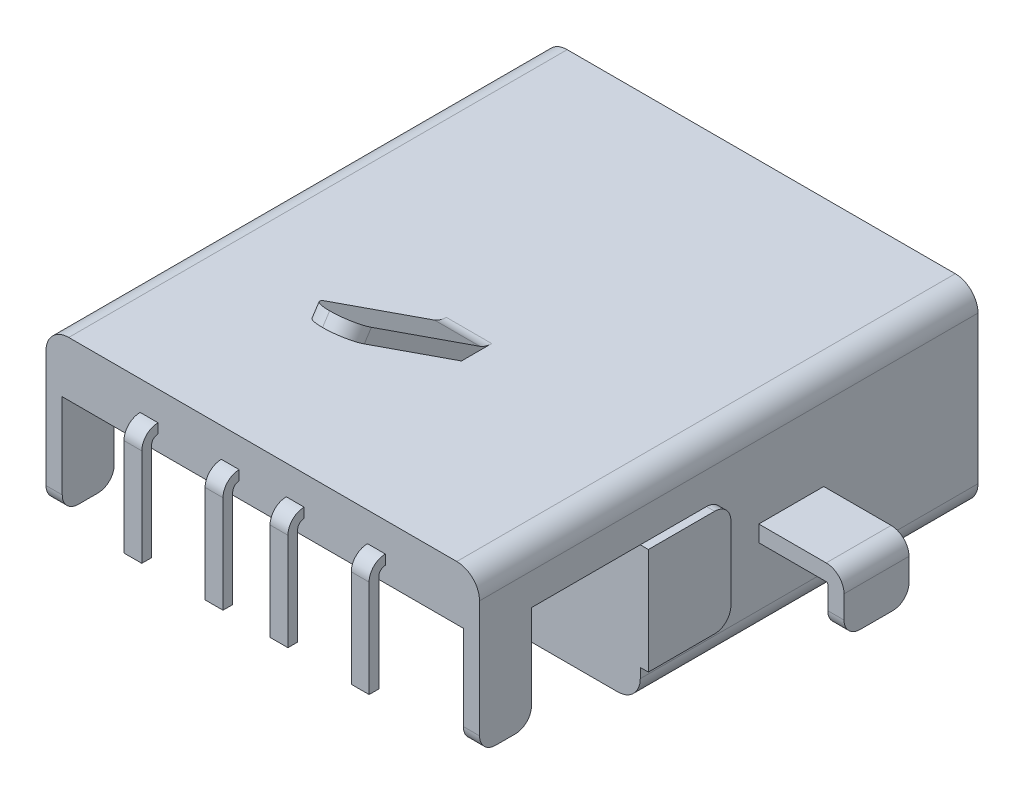
from build123d import *

# Parameters (mm, degrees)
SKIZZE1_W                         = 6.675
SKIZZE1_H                         = 4.27
AUFSATZ_LINEAR_AUSTRAGEN1_DEPTH   = 10.4
SKIZZE1_3_W                       = 6.675
SKIZZE1_3_H                       = 1.68
AUFSATZ_LINEAR_AUSTRAGEN2_DEPTH   = 15.35
LINEAR_AUSTRAGEN_D_NN1_START      = 4.75
LINEAR_AUSTRAGEN_D_NN1_DEPTH      = 2
SKIZZE3_W                         = 0.5
SKIZZE3_H                         = 1.6
AUFSATZ_LINEAR_AUSTRAGEN3_DEPTH   = 4.8
SKIZZE4_W                         = 7.337223246
SKIZZE4_H                         = 4.95
SCHNITT_LINEAR_AUSTRAGEN1_DEPTH   = 8.85
AUFSATZ_LINEAR_AUSTRAGEN4_REACH   = 21.408
AUFSATZ_LINEAR_START              = 0.5
SKIZZE5_W                         = 5.4
SKIZZE5_H                         = 2
AUFSATZ_LINEAR_START_2            = -0.9
SKIZZE6_W                         = 0.55
SKIZZE6_H                         = 0.3
AUFSATZ_LINEAR_AUSTRAGEN5_DEPTH   = 3.5
AUFSATZ_LINEAR_AUSTRAGEN5_2_DEPTH = 3.5
SKIZZE6_3_W                       = 0.55
SKIZZE6_3_H                       = 0.2
AUFSATZ_LINEAR_AUSTRAGEN6_DEPTH   = 0.3
VERRUNDUNG1_R                     = 0.2
VERRUNDUNG2_R                     = 0.5
VERRUNDUNG3_R                     = 0.3
VERRUNDUNG4_R                     = 0.7
AUFSATZ_LINEAR_START_3            = -6.675
SKIZZE7_W                         = 2.54
SKIZZE7_H                         = 3.27
AUFSATZ_LINEAR_AUSTRAGEN7_DEPTH   = 0.25
VERRUNDUNG6_R                     = 0.5
VERRUNDUNG7_R                     = 0.5
LINEAR_AUSTRAGEN_D_NN2_DEPTH      = 0.7
VERRUNDUNG5_R                     = 0.7


with BuildPart() as part:
    # Skizze1 → Aufsatz-Linear austragen1 (new body)
    with BuildSketch(Plane.XY):
        with Locations((-3.3375, -3.815)):
            Rectangle(SKIZZE1_W, SKIZZE1_H)
    extrude(amount=AUFSATZ_LINEAR_AUSTRAGEN1_DEPTH)

    # Skizze1<3> → Aufsatz-Linear austragen2 (add)
    with BuildSketch(Plane.XY):
        with Locations((-3.3375, -0.84)):
            Rectangle(SKIZZE1_3_W, SKIZZE1_3_H)
    extrude(amount=AUFSATZ_LINEAR_AUSTRAGEN2_DEPTH)

    # Skizze2 → Linear-Austragen-Dünn1 (add)
    with BuildSketch(Plane.XY.offset(LINEAR_AUSTRAGEN_D_NN1_START)):
        with BuildLine():
            Line((0, -2.95), (-8.75, -2.95))
            ThreePointArc((-8.75, -2.95), (-9.13890873, -3.11109127), (-9.3, -3.5))
            Line((-9.3, -3.5), (-9.3, -4.7))
            Line((-9.3, -4.7), (-8.8, -4.7))
            Line((-8.8, -4.7), (-8.8, -3.5))
            ThreePointArc((-8.8, -3.5), (-8.785355339, -3.464644661), (-8.75, -3.45))
            Line((-8.75, -3.45), (0, -3.45))
            Line((0, -3.45), (0, -2.95))
        make_face()
    extrude(amount=LINEAR_AUSTRAGEN_D_NN1_DEPTH)

    # Skizze3 → Aufsatz-Linear austragen3 (add)
    with BuildSketch(Plane(origin=(0, 0, 0), x_dir=(1, 0, 0), z_dir=(0, 1, 0))):
        with Locations((-6.425, -14.55)):
            Rectangle(SKIZZE3_W, SKIZZE3_H)
    extrude(amount=-AUFSATZ_LINEAR_AUSTRAGEN3_DEPTH)

    # Skizze4 → Schnitt-Linear austragen1 (cut)
    with BuildSketch(Plane.XY):
        with Locations((-2.511388377, -2.975)):
            Rectangle(SKIZZE4_W, SKIZZE4_H)
    extrude(amount=SCHNITT_LINEAR_AUSTRAGEN1_DEPTH, mode=Mode.SUBTRACT)

    # Skizze5 → Aufsatz-Linear austragen4 (add, up to next)
    with BuildSketch(Plane.XY.offset(AUFSATZ_LINEAR_START), mode=Mode.PRIVATE) as aufsatz_linear_austragen4_sk1:
        with Locations((-2.7, -1.9)):
            Rectangle(SKIZZE5_W, SKIZZE5_H)
    aufsatz_linear_austragen4_tool1 = extrude(aufsatz_linear_austragen4_sk1.sketch, amount=AUFSATZ_LINEAR_AUSTRAGEN4_REACH, mode=Mode.PRIVATE) - part.part
    add(aufsatz_linear_austragen4_tool1.solids().sort_by_distance((-2.7, -1.9, 0.5))[0])



with BuildPart() as body_2:
    # Skizze6 → Aufsatz-Linear austragen5 (new body)
    with BuildSketch(Plane(origin=(0, 0, 0), x_dir=(1, 0, 0), z_dir=(0, 1, 0)).offset(AUFSATZ_LINEAR_START_2)):
        with Locations((-1, -15.7)):
            Rectangle(SKIZZE6_W, SKIZZE6_H)
    extrude(amount=-AUFSATZ_LINEAR_AUSTRAGEN5_DEPTH)


with BuildPart() as body_3:
    # Skizze6 → Aufsatz-Linear austragen5 2 (new body)
    with BuildSketch(Plane(origin=(0, 0, 0), x_dir=(1, 0, 0), z_dir=(0, 1, 0)).offset(AUFSATZ_LINEAR_START_2)):
        with Locations((-3.5, -15.7)):
            Rectangle(SKIZZE6_W, SKIZZE6_H)
    extrude(amount=-AUFSATZ_LINEAR_AUSTRAGEN5_2_DEPTH)


with BuildPart() as part_1:
    add(part.part)

    add(body_2.part)  # Aufsatz-Linear austragen6 merges body 2

    add(body_3.part)  # Aufsatz-Linear austragen6 merges body 3
    # Skizze6<3> → Aufsatz-Linear austragen6 (add)
    with BuildSketch(Plane(origin=(0, 0, 0), x_dir=(1, 0, 0), z_dir=(0, 1, 0)).offset(AUFSATZ_LINEAR_START_2)):
        with Locations((-3.5, -15.45)):
            Rectangle(SKIZZE6_3_W, SKIZZE6_3_H)
        with Locations((-1, -15.45)):
            Rectangle(SKIZZE6_3_W, SKIZZE6_3_H)
    extrude(amount=-AUFSATZ_LINEAR_AUSTRAGEN6_DEPTH)

    # Verrundung1
    verrundung1_edges = [part_1.edges().sort_by_distance(p)[0] for p in [
        (-3.5, -1.2, 15.55),
        (-1, -1.2, 15.55),
    ]]
    fillet(verrundung1_edges, radius=VERRUNDUNG1_R - 0.0001)  # a hair under: the kernel refuses the full size

    # Verrundung2
    verrundung2_edges = [part_1.edges().sort_by_distance(p)[0] for p in [
        (-1, -0.9, 15.85),
        (-3.5, -0.9, 15.85),
    ]]
    fillet(verrundung2_edges, radius=VERRUNDUNG2_R - 0.0001)  # a hair under: the kernel refuses the full size

    # Verrundung3
    verrundung3_edges = [part_1.edges().sort_by_distance(p)[0] for p in [
        (-6.18, -0.5, 4.425),
        (-6.18, -5.45, 4.425),
    ]]
    fillet(verrundung3_edges, radius=VERRUNDUNG3_R)

    # Verrundung4
    verrundung4_edges = [part_1.edges().sort_by_distance(p)[0] for p in [
        (-6.675, 0, 7.675),
        (-6.675, -5.95, 5.2),
    ]]
    fillet(verrundung4_edges, radius=VERRUNDUNG4_R)

    # Skizze7 → Aufsatz-Linear austragen7 (add)
    with BuildSketch(Plane(origin=(0, 0, 0), x_dir=(0, 0, -1), z_dir=(1, 0, 0)).offset(AUFSATZ_LINEAR_START_3)):
        with Locations((-9.13, -3.315)):
            Rectangle(SKIZZE7_W, SKIZZE7_H)
    extrude(amount=-AUFSATZ_LINEAR_AUSTRAGEN7_DEPTH)

    # Verrundung6
    verrundung6_edges = [part_1.edges().sort_by_distance(p)[0] for p in [
        (-9.05, -4.7, 4.75),
        (-9.05, -4.7, 6.75),
        (-6.425, -4.8, 13.75),
        (-6.425, -4.8, 15.35),
    ]]
    fillet(verrundung6_edges, radius=VERRUNDUNG6_R)

    # Verrundung7
    verrundung7_edges = [part_1.edges().sort_by_distance(p)[0] for p in [
        (-6.8, -1.68, 7.86),
        (-6.8, -4.95, 7.86),
    ]]
    fillet(verrundung7_edges, radius=VERRUNDUNG7_R)

    # Spiegeln1: part across plane


with BuildPart() as part_2:
    add(part_1.part)
    add(part_1.part.mirror(Plane(origin=(0, 0, 0), x_dir=(0, 0, 1), z_dir=(1, 0, 0))))

    # Skizze8 → Linear-Austragen-Dünn2 (add, symmetric)
    with BuildSketch(Plane(origin=(0, 0, 0), x_dir=(0, 0, -1), z_dir=(1, 0, 0))):
        with BuildLine():
            Line((-7.127333731, 0), (-9, 0))
            ThreePointArc((-9, 0), (-9.189684168, 0.027582553), (-9.363657097, 0.108045593))
            Line((-9.363657097, 0.108045593), (-13.2907964, 2.667554689))
            Line((-13.2907964, 2.667554689), (-13.5092036, 2.332445311))
            Line((-13.5092036, 2.332445311), (-9.582064297, -0.227063785))
            ThreePointArc((-9.582064297, -0.227063785), (-9.303605739, -0.355851764), (-9, -0.4))
            Line((-9, -0.4), (-7.127333731, -0.4))
            Line((-7.127333731, -0.4), (-7.127333731, 0))
        make_face()
    extrude(amount=LINEAR_AUSTRAGEN_D_NN2_DEPTH, both=True)

    # Verrundung5
    verrundung5_edges = [part_2.edges().sort_by_distance(p)[0] for p in [
        (-0.7, 2.5, 13.4),
        (0.7, 2.5, 13.4),
    ]]
    fillet(verrundung5_edges, radius=VERRUNDUNG5_R - 0.0001)  # a hair under: the kernel refuses the full size


solid = part_2.part
